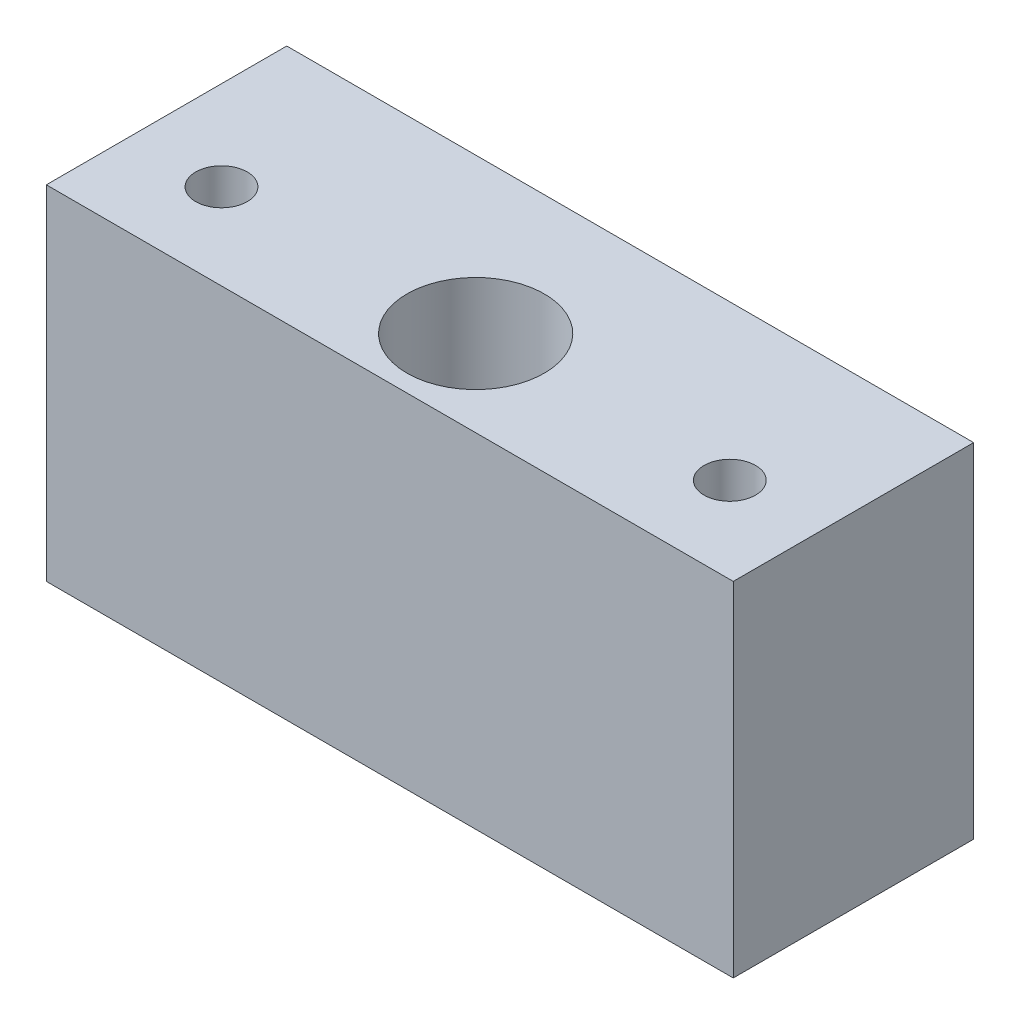
from build123d import *

# Parameters (mm, degrees)
SKETCH3_W           = 100
SKETCH3_H           = 50
BOSS_EXTRUDE1_DEPTH = 25
SKETCH5_R           = 10
SKETCH5_R_2         = 3.75
CUT_EXTRUDE1_DEPTH  = 76
SKETCH7_R           = 2.5
CUT_EXTRUDE4_DEPTH  = 10
BOSS_EXTRUDE2_START = 10
SKETCH8_W           = 100
SKETCH8_H           = 50
SKETCH8_R           = 2.5
BOSS_EXTRUDE2_DEPTH = 10


with BuildPart() as part:
    # Sketch3 → Boss-Extrude1 (new body)
    with BuildSketch(Plane.XY):
        Rectangle(SKETCH3_W, SKETCH3_H)
    extrude(amount=BOSS_EXTRUDE1_DEPTH)

    # Sketch5 → Cut-Extrude1 (cut, through all)
    with BuildSketch(Plane(origin=(0, 25, 0), x_dir=(1, 0, 0), z_dir=(0, 1, 0))):
        with Locations((0, -12.5)):
            Circle(SKETCH5_R)
        with Locations((37, -12.5)):
            Circle(SKETCH5_R_2)
        with Locations((-37, -12.5)):
            Circle(SKETCH5_R_2)
    extrude(amount=-CUT_EXTRUDE1_DEPTH, mode=Mode.SUBTRACT)

    # Sketch7 → Cut-Extrude4 (cut)
    with BuildSketch(Plane(origin=(0, 0, 0), x_dir=(-1, 0, 0), z_dir=(0, 0, -1))):
        with Locations((32.5, 9.25)):
            Circle(SKETCH7_R)
        with Locations((32.5, -9.25)):
            Circle(SKETCH7_R)
        with Locations((-32.5, -9.25)):
            Circle(SKETCH7_R)
        with Locations((-32.5, 9.25)):
            Circle(SKETCH7_R)
    extrude(amount=-CUT_EXTRUDE4_DEPTH, mode=Mode.SUBTRACT)

    # Sketch8 → Boss-Extrude2 (add)
    with BuildSketch(Plane(origin=(0, 0, 0), x_dir=(-1, 0, 0), z_dir=(0, 0, -1)).offset(BOSS_EXTRUDE2_START)):
        Rectangle(SKETCH8_W, SKETCH8_H)
        with Locations((-32.5, 9.25)):
            Circle(SKETCH8_R, mode=Mode.SUBTRACT)
        with Locations((-32.5, -9.25)):
            Circle(SKETCH8_R, mode=Mode.SUBTRACT)
        with Locations((32.5, -9.25)):
            Circle(SKETCH8_R, mode=Mode.SUBTRACT)
        with Locations((32.5, 9.25)):
            Circle(SKETCH8_R, mode=Mode.SUBTRACT)
    extrude(amount=-BOSS_EXTRUDE2_DEPTH)


solid = part.part
